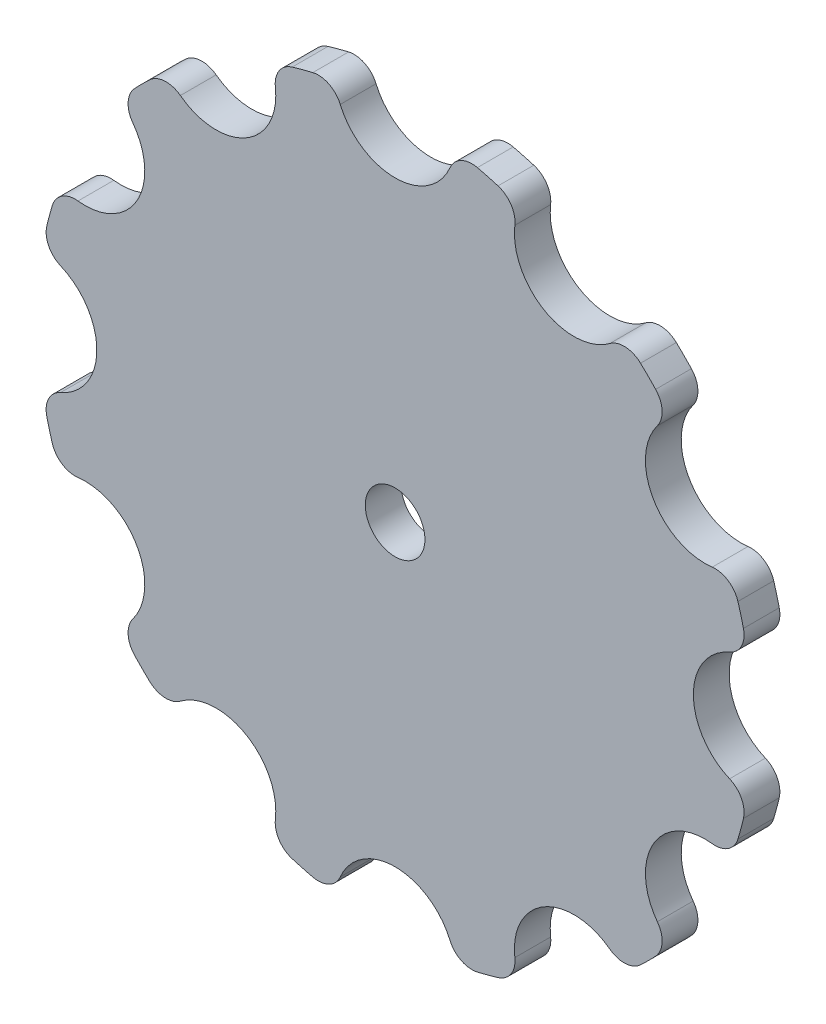
from build123d import *

# Parameters (mm, degrees)
BOSS_EXTRUDE1_DEPTH = 3
FILLET1_R           = 2
FILLET2_R           = 2
SKETCH2_R           = 2.5
CUT_EXTRUDE1_DEPTH  = 10


with BuildPart() as part:
    # Sketch1 → Boss-Extrude1 (new body)
    with BuildSketch(Plane.XY):
        with BuildLine():
            ThreePointArc((29.583333333, -4.982608643), (25, 0), (29.583333333, 4.982608643))
            ThreePointArc((29.583333333, 4.982608643), (28.977774789, 7.764571353), (28.111222517, 10.476601005))
            ThreePointArc((28.111222517, 10.476601005), (21.650635095, 12.5), (23.128613874, 19.106732329))
            ThreePointArc((23.128613874, 19.106732329), (21.213203436, 21.213203436), (19.106732329, 23.128613874))
            ThreePointArc((19.106732329, 23.128613874), (12.5, 21.650635095), (10.476601005, 28.111222517))
            ThreePointArc((10.476601005, 28.111222517), (7.764571353, 28.977774789), (4.982608643, 29.583333333))
            ThreePointArc((4.982608643, 29.583333333), (0, 25), (-4.982608643, 29.583333333))
            ThreePointArc((-4.982608643, 29.583333333), (-7.764571353, 28.977774789), (-10.476601005, 28.111222517))
            ThreePointArc((-10.476601005, 28.111222517), (-10.120604803, 27.072321783), (-10, 25.980762114))
            ThreePointArc((-10, 25.980762114), (-13.505620805, 21.209302083), (-19.106732329, 23.128613874))
            ThreePointArc((-19.106732329, 23.128613874), (-21.213203436, 21.213203436), (-23.128613874, 19.106732329))
            ThreePointArc((-23.128613874, 19.106732329), (-21.550144707, 17.317246081), (-20.980762114, 15))
            ThreePointArc((-20.980762114, 15), (-23.302357926, 10.777897324), (-28.111222517, 10.476601005))
            ThreePointArc((-28.111222517, 10.476601005), (-28.977774789, 7.764571353), (-29.583333333, 4.982608643))
            ThreePointArc((-29.583333333, 4.982608643), (-26.320099639, 3.385016002), (-25, 0))
            ThreePointArc((-25, 0), (-26.320099639, -3.385016002), (-29.583333333, -4.982608643))
            ThreePointArc((-29.583333333, -4.982608643), (-28.977774789, -7.764571353), (-28.111222517, -10.476601005))
            ThreePointArc((-28.111222517, -10.476601005), (-23.302357926, -10.777897324), (-20.980762114, -15))
            ThreePointArc((-20.980762114, -15), (-21.550144707, -17.317246081), (-23.128613874, -19.106732329))
            ThreePointArc((-23.128613874, -19.106732329), (-21.213203436, -21.213203436), (-19.106732329, -23.128613874))
            ThreePointArc((-19.106732329, -23.128613874), (-13.505620805, -21.209302083), (-10, -25.980762114))
            ThreePointArc((-10, -25.980762114), (-10.120604803, -27.072321783), (-10.476601005, -28.111222517))
            ThreePointArc((-10.476601005, -28.111222517), (-7.764571353, -28.977774789), (-4.982608643, -29.583333333))
            ThreePointArc((-4.982608643, -29.583333333), (0, -25), (4.982608643, -29.583333333))
            ThreePointArc((4.982608643, -29.583333333), (7.764571353, -28.977774789), (10.476601005, -28.111222517))
            ThreePointArc((10.476601005, -28.111222517), (12.5, -21.650635095), (19.106732329, -23.128613874))
            ThreePointArc((19.106732329, -23.128613874), (21.213203436, -21.213203436), (23.128613874, -19.106732329))
            ThreePointArc((23.128613874, -19.106732329), (21.650635095, -12.5), (28.111222517, -10.476601005))
            ThreePointArc((28.111222517, -10.476601005), (28.977774789, -7.764571353), (29.583333333, -4.982608643))
        make_face()
    extrude(amount=BOSS_EXTRUDE1_DEPTH)

    # Fillet1
    fillet1_edges = [part.edges().sort_by_distance(p)[0] for p in [
        (-23.128613874, 19.106732329, 1.5),
        (-19.106732329, 23.128613874, 1.5),
        (-4.982608643, 29.583333333, 1.5),
        (-10.476601005, 28.111222517, 1.5),
    ]]
    fillet(fillet1_edges, radius=FILLET1_R)

    # Fillet2
    fillet2_edges = [part.edges().sort_by_distance(p)[0] for p in [
        (-28.111222517, 10.476601005, 1.5),
        (-29.583333333, 4.982608643, 1.5),
        (-29.583333333, -4.982608643, 1.5),
        (-28.111222517, -10.476601005, 1.5),
        (-23.128613874, -19.106732329, 1.5),
        (-19.106732329, -23.128613874, 1.5),
        (-10.476601005, -28.111222517, 1.5),
        (-4.982608643, -29.583333333, 1.5),
        (4.982608643, -29.583333333, 1.5),
        (10.476601005, -28.111222517, 1.5),
        (19.106732329, -23.128613874, 1.5),
        (23.128613874, -19.106732329, 1.5),
        (28.111222517, -10.476601005, 1.5),
        (29.583333333, -4.982608643, 1.5),
        (29.583333333, 4.982608643, 1.5),
        (28.111222517, 10.476601005, 1.5),
        (23.128613874, 19.106732329, 1.5),
        (19.106732329, 23.128613874, 1.5),
        (4.982608643, 29.583333333, 1.5),
        (10.476601005, 28.111222517, 1.5),
    ]]
    fillet(fillet2_edges, radius=FILLET2_R)

    # Sketch2 → Cut-Extrude1 (cut)
    with BuildSketch(Plane(origin=(0, 0, 0), x_dir=(-1, 0, 0), z_dir=(0, 0, -1))):
        Circle(SKETCH2_R)
    extrude(amount=-CUT_EXTRUDE1_DEPTH, mode=Mode.SUBTRACT)


solid = part.part
